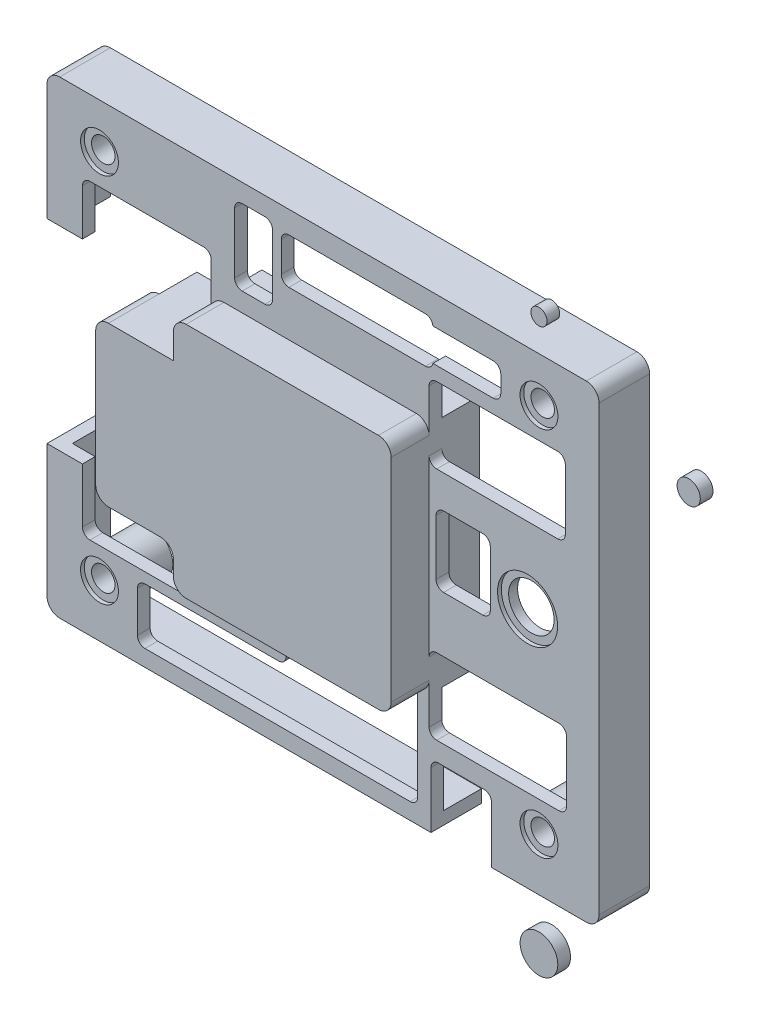
from build123d import *

# Parameters (mm, degrees)
SKETCH_1_R          = 1.531489915
EXTRUDE_1_DEPTH     = 1.68
SKETCH_1_R_2        = 1.063949022
EXTRUDE_1_2_DEPTH   = 1.68
SKETCH_1_R_3        = 2.489250022
EXTRUDE_1_3_DEPTH   = 1.68
SKETCH_1_W          = 72.86
SKETCH_1_H          = 61.86
SKETCH_1_R_4        = 1.55
EXTRUDE_1_4_DEPTH   = 1.68
SKETCH_2_R          = 3
SKETCH_2_R_2        = 1.55
EXTRUDE_3_DEPTH     = 6.68
SKETCH_3_W          = 72.86
SKETCH_3_H          = 61.86
SKETCH_3_W_2        = 69.50125591
SKETCH_3_H_2        = 58.5
EXTRUDE_4_DEPTH     = 6.68
SKETCH_4_R          = 3
SKETCH_4_W          = 7.154913855
SKETCH_4_H          = 9.312650428
SKETCH_4_W_2        = 5
SKETCH_4_H_2        = 10
SKETCH_4_W_3        = 17.98013714
SKETCH_4_W_4        = 18.141117771
SKETCH_4_W_5        = 8
SKETCH_4_H_3        = 8.433214487
CUT_EXTRUDE_1_DEPTH = 10
EXTRUDE_5_DEPTH     = 5
CUT_EXTRUDE_2_DEPTH = 5
FILLET_1_R          = 1.68
FILLET_2_R          = 1.68
FILLET_3_R          = 1
SKETCH_7_R          = 2.5
SKETCH_7_R_2        = 3.964271716
CUT_EXTRUDE_3_DEPTH = 0.5
EXTRUDE_6_DEPTH     = 5


with BuildPart() as part:
    # 草图1 → 凸台-拉伸1 (new body)
    with BuildSketch(Plane.XY):
        with Locations((1.504266973, 51.672660554)):
            Circle(SKETCH_1_R)
    extrude(amount=EXTRUDE_1_DEPTH)


with BuildPart() as body_2:
    # 草图1 → Extrude 1 2 (new body)
    with BuildSketch(Plane.XY):
        with Locations((-18.258772408, 61.840992468)):
            Circle(SKETCH_1_R_2)
    extrude(amount=EXTRUDE_1_2_DEPTH)


with BuildPart() as body_3:
    # 草图1 → Extrude 1 3 (new body)
    with BuildSketch(Plane.XY):
        with Locations((-18.258772408, -10.975845657)):
            Circle(SKETCH_1_R_3)
    extrude(amount=EXTRUDE_1_3_DEPTH)


with BuildPart() as body_4:
    # 草图1 → Extrude 1 4 (new body)
    with BuildSketch(Plane.XY):
        with Locations((-46.758772408, 26.672660554)):
            Rectangle(SKETCH_1_W, SKETCH_1_H)
        with Locations((-76.258772408, 51.672660554)):
            Circle(SKETCH_1_R_4, mode=Mode.SUBTRACT)
        with Locations((-18.258772408, 51.672660554)):
            Circle(SKETCH_1_R_4, mode=Mode.SUBTRACT)
        with Locations((-76.258772408, 2.672660554)):
            Circle(SKETCH_1_R_4, mode=Mode.SUBTRACT)
        with Locations((-18.258772408, 2.672660554)):
            Circle(SKETCH_1_R_4, mode=Mode.SUBTRACT)
    extrude(amount=EXTRUDE_1_4_DEPTH)

    # 草图2 → 凸台-拉伸3 (add)
    # profile 1 of 4: a face of its own
    with BuildSketch(Plane.XY.offset(1.68)):
        with Locations((-76.258772408, 2.672660554)):
            Circle(SKETCH_2_R)
        with Locations((-76.258772408, 2.672660554)):
            Circle(SKETCH_2_R_2, mode=Mode.SUBTRACT)
    # profile 2 of 4: a face of its own
    with BuildSketch(Plane.XY.offset(1.68)):
        with Locations((-18.258772408, 2.672660554)):
            Circle(SKETCH_2_R)
        with Locations((-18.258772408, 2.672660554)):
            Circle(SKETCH_2_R_2, mode=Mode.SUBTRACT)
    # profile 3 of 4: a face of its own
    with BuildSketch(Plane.XY.offset(1.68)):
        with Locations((-76.258772408, 51.672660554)):
            Circle(SKETCH_2_R)
        with Locations((-76.258772408, 51.672660554)):
            Circle(SKETCH_2_R_2, mode=Mode.SUBTRACT)
    # profile 4 of 4: a face of its own
    with BuildSketch(Plane.XY.offset(1.68)):
        with Locations((-18.258772408, 51.672660554)):
            Circle(SKETCH_2_R)
        with Locations((-18.258772408, 51.672660554)):
            Circle(SKETCH_2_R_2, mode=Mode.SUBTRACT)
    extrude(amount=-EXTRUDE_3_DEPTH)

    # 草图3 → 凸台-拉伸4 (add)
    with BuildSketch(Plane.XY.offset(1.68)):
        with Locations((-46.758772408, 26.672660554)):
            Rectangle(SKETCH_3_W, SKETCH_3_H)
        with Locations((-46.758144453, 26.672660554)):
            Rectangle(SKETCH_3_W_2, SKETCH_3_H_2, mode=Mode.SUBTRACT)
    extrude(amount=-EXTRUDE_4_DEPTH)

    # 草图4 → 切除-拉伸1 (cut)
    with BuildSketch(Plane.XY.offset(1.68)):
        with Locations((-19.758772408, 27.672660554)):
            Circle(SKETCH_4_R)
        Polygon((-83.188772408, 40.576705556), (-83.188772408, 14.86911006), (-78.508772408, 14.86911006), (-78.508772408, 6.672660554), (-61.508772408, 6.672660554), (-61.508772408, 16.672660554), (-71.758772408, 16.672660554), (-71.758772408, 37.672660554), (-61.508772408, 37.672660554), (-61.508772408, 47.672660554), (-76.258772408, 47.672660554), (-78.508772408, 47.672660554), (-78.508772408, 40.576705556), align=None)
        with Locations((-28.258772408, 28.672660554)):
            Rectangle(SKETCH_4_W, SKETCH_4_H)
        with Locations((-55.924462772, 50.172660554)):
            Rectangle(SKETCH_4_W_2, SKETCH_4_H_2)
        Polygon((-52.258772408, 54.672660554), (-32.258772408, 54.672660554), (-32.258772408, 53.764839792), (-23.297653485, 53.764839792), (-23.297653485, 49.490952702), (-32.258772408, 49.490952702), (-32.258772408, 48.677526196), (-52.258772408, 48.677526196), align=None)
        with Locations((-23.768703838, 42.672660554)):
            Rectangle(SKETCH_4_W_3, SKETCH_4_H_2)
        with Locations((-23.688213522, 11.672660554)):
            Rectangle(SKETCH_4_W_4, SKETCH_4_H_2)
        Polygon((-71.258772408, -2.090920311), (-34.258772408, -2.090920311), (-34.258772408, 11.36989868), (-51.63107774, 11.36989868), (-51.63107774, 5.290547857), (-71.258772408, 5.290547857), align=None)
        with Locations((-28.508772408, -0.040732203)):
            Rectangle(SKETCH_4_W_5, SKETCH_4_H_3)
    extrude(amount=-CUT_EXTRUDE_1_DEPTH, mode=Mode.SUBTRACT)

    # 草图5 → 凸台-拉伸5 (add)
    with BuildSketch(Plane.XY.offset(1.68)):
        Polygon((-71.758772408, 37.672660554), (-71.758772408, 16.672660554), (-61.508772408, 16.672660554), (-61.508772408, 11.348555782), (-32.758772408, 11.348555782), (-32.758772408, 42.672660554), (-61.508772408, 42.672660554), (-61.508772408, 37.672660554), align=None)
    extrude(amount=EXTRUDE_5_DEPTH)

    # 草图6 → 切除-拉伸2 (cut)
    with BuildSketch(Plane(origin=(0, 0, 0), x_dir=(-1, 0, 0), z_dir=(0, 0, -1))):
        Polygon((34.438772408, 35.992660554), (34.438772408, 18.352660554), (34.438772408, 14.075018193), (60.085100024, 14.075018193), (60.085100024, 18.352660554), (70.078772408, 18.352660554), (70.078772408, 35.992660554), (60.085100024, 35.992660554), (60.085100024, 39.998351851), (34.438772408, 39.998351851), align=None)
    extrude(amount=-CUT_EXTRUDE_2_DEPTH, mode=Mode.SUBTRACT)

    # 圆角1
    fillet_1_edges = [body_4.edges().sort_by_distance(p)[0] for p in [
        (-12.007516498, -2.577339446, -2.5),
        (-81.508772408, -2.577339446, -2.5),
        (-81.508772408, 55.922660554, -2.5),
        (-12.007516498, 55.922660554, -2.5),
        (-10.328772408, -4.257339446, -1.66),
        (-83.188772408, -4.257339446, -1.66),
        (-83.188772408, 57.602660554, -1.66),
        (-10.328772408, 57.602660554, -1.66),
    ]]
    fillet(fillet_1_edges, radius=FILLET_1_R)

    # 圆角2
    # the kernel refuses this fillet: 1.68 mm, written as the material it adds along each edge
    with BuildSketch(Plane(origin=(-61.508772408, 16.672660554, 1.68), x_dir=(0, -1, 0), z_dir=(0, 0, 1))) as fillet_2_piece_1:
        with BuildLine():
            CenterArc((FILLET_2_R, -FILLET_2_R), FILLET_2_R, 90, 90)
            Line((0, -FILLET_2_R), (0, 0))
            Line((0, 0), (FILLET_2_R, 0))
        make_face()
    extrude(amount=5)
    with BuildSketch(Plane(origin=(-61.508772408, 16.672660554, 1.68), x_dir=(0, -1, 0), z_dir=(0, 0, -1))) as fillet_2_piece_2:
        with BuildLine():
            CenterArc((FILLET_2_R, FILLET_2_R), FILLET_2_R, 180, 90)
            Line((0, FILLET_2_R), (0, 0))
            Line((0, 0), (FILLET_2_R, 0))
        make_face()
    extrude(amount=1.68)
    # the kernel refuses this fillet: 1.68 mm, written as the material it takes off along each edge
    with BuildSketch(Plane(origin=(-71.758772408, 37.672660554, 1.68), x_dir=(1, 0, 0), z_dir=(0, 0, 1)), Plane(origin=(-71.758772408, 16.672660554, 1.68), x_dir=(0, 1, 0), z_dir=(0, 0, 1)), Plane(origin=(-61.508772408, 11.348555782, 1.68), x_dir=(0, 1, 0), z_dir=(0, 0, 1)), Plane(origin=(-32.758772408, 11.348555782, 1.68), x_dir=(-1, 0, 0), z_dir=(0, 0, 1)), Plane(origin=(-32.758772408, 42.672660554, 1.68), x_dir=(0, -1, 0), z_dir=(0, 0, 1))) as fillet_2_2_piece_1:
        with BuildLine():
            CenterArc((FILLET_2_R, -FILLET_2_R), FILLET_2_R, 90, 90)
            Line((0, -FILLET_2_R), (0, 0))
            Line((0, 0), (FILLET_2_R, 0))
        make_face()
    extrude(amount=9.2, mode=Mode.SUBTRACT)
    with BuildSketch(Plane(origin=(-61.508772408, 42.672660554, 1.68), x_dir=(0, -1, 0), z_dir=(0, 0, 1))) as fillet_2_2_piece_2:
        with BuildLine():
            CenterArc((FILLET_2_R, FILLET_2_R), FILLET_2_R, 180, 90)
            Line((0, FILLET_2_R), (0, 0))
            Line((0, 0), (FILLET_2_R, 0))
        make_face()
    extrude(amount=9.2, mode=Mode.SUBTRACT)
    with BuildSketch(Plane(origin=(-71.758772408, 16.672660554, 1.68), x_dir=(0, 1, 0), z_dir=(0, 0, -1)), Plane(origin=(-71.758772408, 37.672660554, 1.68), x_dir=(1, 0, 0), z_dir=(0, 0, -1))) as fillet_2_2_piece_3:
        with BuildLine():
            CenterArc((FILLET_2_R, FILLET_2_R), FILLET_2_R, 180, 90)
            Line((0, FILLET_2_R), (0, 0))
            Line((0, 0), (FILLET_2_R, 0))
        make_face()
    extrude(amount=5.88, mode=Mode.SUBTRACT)

    # 圆角3
    # the kernel refuses this fillet: 1 mm, written as the material it adds along each edge
    with BuildSketch(Plane(origin=(-23.297653485, 53.764839792, 1.68), x_dir=(-1, 0, 0), z_dir=(0, 0, -1)), Plane(origin=(-23.297653485, 49.490952702, 1.68), x_dir=(0, 1, 0), z_dir=(0, 0, -1)), Plane(origin=(-52.258772408, 48.677526196, 1.68), x_dir=(1, 0, 0), z_dir=(0, 0, -1)), Plane(origin=(-52.258772408, 54.672660554, 1.68), x_dir=(0, -1, 0), z_dir=(0, 0, -1)), Plane(origin=(-58.424462772, 55.172660554, 1.68), x_dir=(0, -1, 0), z_dir=(0, 0, -1)), Plane(origin=(-53.424462772, 45.172660554, 1.68), x_dir=(0, 1, 0), z_dir=(0, 0, -1)), Plane(origin=(-58.424462772, 45.172660554, 1.68), x_dir=(1, 0, 0), z_dir=(0, 0, -1)), Plane(origin=(-78.508772408, 47.672660554, 1.68), x_dir=(0, -1, 0), z_dir=(0, 0, -1)), Plane(origin=(-78.508772408, 6.672660554, 1.68), x_dir=(1, 0, 0), z_dir=(0, 0, -1)), Plane(origin=(-32.508772408, 4.175875041, 1.68), x_dir=(0, -1, 0), z_dir=(0, 0, -1)), Plane(origin=(-24.508772408, 4.175875041, 1.68), x_dir=(-1, 0, 0), z_dir=(0, 0, -1)), Plane(origin=(-32.758772408, 16.672660554, 1.68), x_dir=(0, -1, 0), z_dir=(0, 0, -1)), Plane(origin=(-14.617654637, 16.672660554, 1.68), x_dir=(-1, 0, 0), z_dir=(0, 0, -1)), Plane(origin=(-14.617654637, 6.672660554, 1.68), x_dir=(0, 1, 0), z_dir=(0, 0, -1)), Plane(origin=(-32.758772408, 47.672660554, 1.68), x_dir=(0, -1, 0), z_dir=(0, 0, -1)), Plane(origin=(-14.778635268, 47.672660554, 1.68), x_dir=(-1, 0, 0), z_dir=(0, 0, -1)), Plane(origin=(-14.778635268, 37.672660554, 1.68), x_dir=(0, 1, 0), z_dir=(0, 0, -1)), Plane(origin=(-24.68131548, 24.01633534, 1.68), x_dir=(0, 1, 0), z_dir=(0, 0, -1)), Plane(origin=(-31.836229335, 33.328985768, 1.68), x_dir=(0, -1, 0), z_dir=(0, 0, -1)), Plane(origin=(-31.836229335, 24.01633534, 1.68), x_dir=(1, 0, 0), z_dir=(0, 0, -1))) as fillet_3_piece_1:
        with BuildLine():
            CenterArc((FILLET_3_R, -FILLET_3_R), FILLET_3_R, 90, 90)
            Line((0, -FILLET_3_R), (0, 0))
            Line((0, 0), (FILLET_3_R, 0))
        make_face()
    extrude(amount=1.68)
    with BuildSketch(Plane(origin=(-32.258772408, 48.677526196, 1.68), x_dir=(0, 1, 0), z_dir=(0, 0, -1))) as fillet_3_piece_2:
        with BuildLine():
            CenterArc((1, -0.982441006), FILLET_3_R, 100.75288438, 79.24711562)
            Line((0, -0.982441007), (0, 0))
            Line((0, 0), (0.813426506, 0))
        make_face()
    extrude(amount=1.68)
    with BuildSketch(Plane(origin=(-32.258772408, 54.672660554, 1.68), x_dir=(0, -1, 0), z_dir=(0, 0, -1))) as fillet_3_piece_3:
        with BuildLine():
            CenterArc((1, 0.995742431), FILLET_3_R, 180, 84.71101048)
            Line((0, 0.995742431), (0, 0))
            Line((0, 0), (0.907820762, 0))
        make_face()
    extrude(amount=1.68)
    with BuildSketch(Plane(origin=(-53.424462772, 55.172660554, 1.68), x_dir=(0, -1, 0), z_dir=(0, 0, -1)), Plane(origin=(-61.508772408, 47.672660554, 1.68), x_dir=(0, -1, 0), z_dir=(0, 0, -1)), Plane(origin=(-61.508772408, 6.672660554, 1.68), x_dir=(-1, 0, 0), z_dir=(0, 0, -1)), Plane(origin=(-71.258772408, -2.090920311, 1.68), x_dir=(0, 1, 0), z_dir=(0, 0, -1)), Plane(origin=(-71.258772408, 5.290547857, 1.68), x_dir=(1, 0, 0), z_dir=(0, 0, -1)), Plane(origin=(-34.258772408, -2.090920311, 1.68), x_dir=(-1, 0, 0), z_dir=(0, 0, -1)), Plane(origin=(-32.758772408, 6.672660554, 1.68), x_dir=(0, 1, 0), z_dir=(0, 0, -1)), Plane(origin=(-32.758772408, 37.672660554, 1.68), x_dir=(0, 1, 0), z_dir=(0, 0, -1)), Plane(origin=(-24.68131548, 33.328985768, 1.68), x_dir=(0, -1, 0), z_dir=(0, 0, -1))) as fillet_3_piece_4:
        with BuildLine():
            CenterArc((FILLET_3_R, FILLET_3_R), FILLET_3_R, 180, 90)
            Line((0, FILLET_3_R), (0, 0))
            Line((0, 0), (FILLET_3_R, 0))
        make_face()
    extrude(amount=1.68)
    # the kernel refuses this fillet: 1 mm, written as the material it takes off along each edge
    with BuildSketch(Plane(origin=(-51.63107774, 5.290547857, 4.18), x_dir=(-1, 0, 0), z_dir=(0, 0, -1))) as fillet_3_2_piece_1:
        with BuildLine():
            CenterArc((FILLET_3_R, FILLET_3_R), FILLET_3_R, 180, 90)
            Line((0, FILLET_3_R), (0, 0))
            Line((0, 0), (FILLET_3_R, 0))
        make_face()
    extrude(amount=6.68, mode=Mode.SUBTRACT)

    # 草图7 → 切除-拉伸3 (cut)
    with BuildSketch(Plane.XY.offset(1.68)):
        with Locations((-76.258772408, 51.672660554)):
            Circle(SKETCH_7_R)
        with Locations((-76.258772408, 2.672660554)):
            Circle(SKETCH_7_R)
        with Locations((-18.258772408, 2.672660554)):
            Circle(SKETCH_7_R)
        with Locations((-18.258772408, 51.672660554)):
            Circle(SKETCH_7_R)
        with Locations((-19.758772408, 27.672660554)):
            Circle(SKETCH_7_R_2)
    extrude(amount=-CUT_EXTRUDE_3_DEPTH, mode=Mode.SUBTRACT)

    # 草图8 → 凸台-拉伸6 (add)
    with BuildSketch(Plane(origin=(0, 0, 0), x_dir=(-1, 0, 0), z_dir=(0, 0, -1))):
        Polygon((51.63107774, 11.36989868), (32.758772408, 11.36989868), (32.758772408, 42.205054718), (61.508772408, 42.205054718), (61.508772408, 37.672660554), (70.078772408, 37.672660554), (71.758772408, 35.992660554), (71.758772408, 18.352660554), (70.078772408, 16.672660554), (63.188772408, 16.672660554), (61.508772408, 16.672660554), (61.508772408, 11.672660554), (61.508772408, 11.36989868), align=None)
        Polygon((60.085100024, 14.075018193), (60.085100024, 18.352660554), (70.078772408, 18.352660554), (70.078772408, 35.992660554), (60.085100024, 35.992660554), (60.085100024, 39.998351851), (34.438772408, 39.998351851), (34.438772408, 14.075018193), align=None, mode=Mode.SUBTRACT)
    extrude(amount=EXTRUDE_6_DEPTH)


solid = Compound([part.part, body_2.part, body_3.part, body_4.part])
